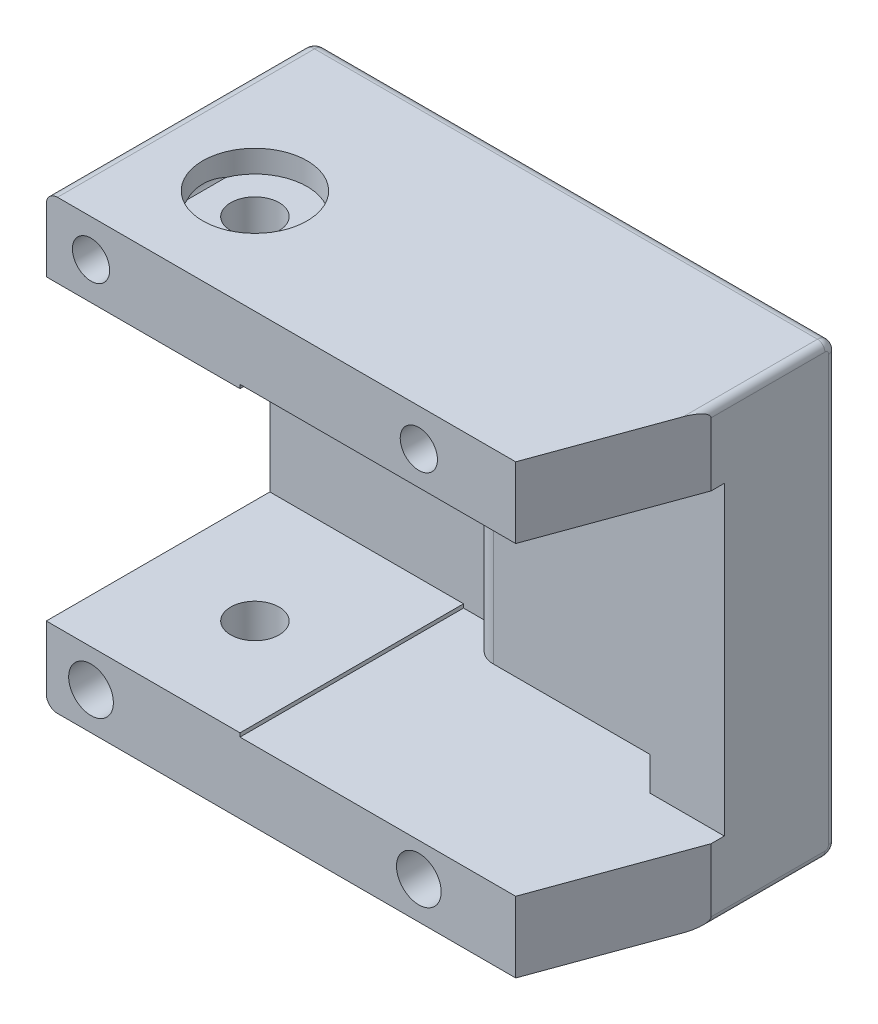
from build123d import *

# Parameters (mm, degrees)
SKETCH1_W              = 35
SKETCH1_H              = 20
BASE_PLATE_DEPTH       = 3
SKETCH2_W              = 35
SKETCH2_H              = 5
SIDE_WALLS_DEPTH       = 18
SKETCH4_R              = 1.5
SKETCH4_R_2            = 1.25
M2_SCREWS_DEPTH        = 18
SKETCH6_W              = 5
SKETCH6_H              = 20
RETURN_STOPPER_DEPTH   = 4.5
SKETCH9_W              = 12
SKETCH9_H              = 16
BOSS_EXTRUDE1_DEPTH    = 4.5
SKETCH7_R              = 7.75
MAGNET_POCKET_DEPTH    = 6
SKETCH8_R              = 2
M2_SCREW_HEAD_DEPTH    = 1.5
M3_ACHSLE_DEPTH        = 36.429507476
M3_ACHSLE_DEPTH_BACK   = 36.429507476
SKETCH5_R              = 1.625
SKETCH14_R             = 3.5
CUT_EXTRUDE1_DEPTH     = 1.5
CUT_EXTRUDE2_START     = -1.5
SKETCH15_R             = 3.5
CUT_EXTRUDE2_DEPTH     = 1.5
FILLET1_R              = 1.5
LEAVER_START           = -0.25
SKETCH11_W             = 22
SKETCH11_H             = 10.5
LEAVER_SPACE_DEPTH     = 20.5
SKETCH12_W             = 17
SKETCH12_H             = 4.5
MORE_SPACE_LEFT_DEPTH  = 0.25
SKETCH13_W             = 17
SKETCH13_H             = 4.5
MORE_SPACE_RIGHT_DEPTH = 0.25
FILLET2_R              = 0.75
FILLET3_R              = 0.75
FILLET4_R              = 0.75
FILLET5_R              = 0.5
CHAMFER1_SIZE          = 3.5
CHAMFER1_SIZE_2        = 9.616170968


with BuildPart() as part:
    # Sketch1 → Base Plate (new body)
    with BuildSketch(Plane.XY):
        Rectangle(SKETCH1_W, SKETCH1_H)
    extrude(amount=BASE_PLATE_DEPTH)

    # Sketch2 → Side Walls (add)
    with BuildSketch(Plane(origin=(0, 0, 0), x_dir=(1, 0, 0), z_dir=(0, 0, -1))):
        with Locations((0, -12.5)):
            Rectangle(SKETCH2_W, SKETCH2_H)
        with Locations((0, 12.5)):
            Rectangle(SKETCH2_W, SKETCH2_H)
    extrude(amount=-SIDE_WALLS_DEPTH)

    # Sketch4 → M2 Screws (cut)
    with BuildSketch(Plane.XY.offset(18)):
        with Locations((-14.5, -12.5)):
            Circle(SKETCH4_R)
        with Locations((7.5, -12.5)):
            Circle(SKETCH4_R)
        with Locations((7.5, 12.5)):
            Circle(SKETCH4_R_2)
        with Locations((-14.5, 12.5)):
            Circle(SKETCH4_R_2)
    extrude(amount=-M2_SCREWS_DEPTH, mode=Mode.SUBTRACT)

    # Sketch6 → Return Stopper (add)
    with BuildSketch(Plane.XY.offset(3)):
        with Locations((15, 0)):
            Rectangle(SKETCH6_W, SKETCH6_H)
    extrude(amount=RETURN_STOPPER_DEPTH)

    # Sketch9 → Boss-Extrude1 (add)
    with BuildSketch(Plane.XY.offset(3)):
        with Locations((6.5, 0)):
            Rectangle(SKETCH9_W, SKETCH9_H)
    extrude(amount=BOSS_EXTRUDE1_DEPTH)

    # Sketch7 → Magnet Pocket (cut)
    with BuildSketch(Plane(origin=(0, 0, 0), x_dir=(-1, 0, 0), z_dir=(0, 0, 1))):
        with Locations(Location((-8.75, 0, 0), (0, 0, 90))):
            Circle(SKETCH7_R)
    extrude(amount=MAGNET_POCKET_DEPTH, mode=Mode.SUBTRACT)

    # Sketch8 → M2 Screw Head (cut)
    with BuildSketch(Plane(origin=(0, 0, 0), x_dir=(1, 0, 0), z_dir=(0, 0, -1))):
        with Locations(Location((7.5, -12.5, 0), (0, 0, 270))):
            Circle(SKETCH8_R)
        with Locations(Location((-14.5, -12.5, 0), (0, 0, 270))):
            Circle(SKETCH8_R)
        with Locations(Location((7.5, 12.5, 0), (0, 0, 270))):
            Circle(SKETCH8_R)
        with Locations(Location((-14.5, 12.5, 0), (0, 0, 270))):
            Circle(SKETCH8_R)
    extrude(amount=-M2_SCREW_HEAD_DEPTH, mode=Mode.SUBTRACT)

    # Sketch5 → M3 Achsle (cut, two sides: drawn at the far end of the back side and taken through both)
    with BuildSketch(Plane.XZ.offset(-10).offset(-M3_ACHSLE_DEPTH_BACK)):
        with Locations((-10.5, 11)):
            Circle(SKETCH5_R)
    extrude(amount=M3_ACHSLE_DEPTH + M3_ACHSLE_DEPTH_BACK, mode=Mode.SUBTRACT)

    # Sketch14 → Cut-Extrude1 (cut)
    with BuildSketch(Plane(origin=(0, 15, 0), x_dir=(-1, 0, 0), z_dir=(0, 1, 0))):
        with Locations((10.5, 11)):
            Circle(SKETCH14_R)
    extrude(amount=-CUT_EXTRUDE1_DEPTH, mode=Mode.SUBTRACT)

    # Sketch15 → Cut-Extrude2 (cut)
    with BuildSketch(Plane.XZ.offset(15).offset(CUT_EXTRUDE2_START)):
        with Locations(Location((-10.5, 11, 0), (0, 0, 180))):
            Circle(SKETCH15_R)
    extrude(amount=CUT_EXTRUDE2_DEPTH, mode=Mode.SUBTRACT)

    # Fillet1
    fillet1_edges = [part.edges().sort_by_distance(p)[0] for p in [
        (0.5, 0, 7.5),
    ]]
    fillet(fillet1_edges, radius=FILLET1_R)

    # Sketch11 → Leaver Space (cut)
    with BuildSketch(Plane.XZ.offset(-10).offset(LEAVER_START)):
        with Locations((6.5, 12.75)):
            Rectangle(SKETCH11_W, SKETCH11_H)
    extrude(amount=LEAVER_SPACE_DEPTH, mode=Mode.SUBTRACT)

    # Sketch12 → More Space left (cut)
    with BuildSketch(Plane.XZ.offset(-10)):
        with Locations((4, 5.25)):
            Rectangle(SKETCH12_W, SKETCH12_H)
    extrude(amount=-MORE_SPACE_LEFT_DEPTH, mode=Mode.SUBTRACT)

    # Sketch13 → More Space right (cut)
    with BuildSketch(Plane(origin=(0, -10, 0), x_dir=(-1, 0, 0), z_dir=(0, 1, 0))):
        with Locations((-4, 5.25)):
            Rectangle(SKETCH13_W, SKETCH13_H)
    extrude(amount=-MORE_SPACE_RIGHT_DEPTH, mode=Mode.SUBTRACT)

    # Fillet2
    # the kernel refuses this fillet: 0.75 mm, written as the material it takes off along each edge
    with BuildSketch(Plane(origin=(19.375, 15, 0), x_dir=(0, -1, 0), z_dir=(-1, 0, 0))) as fillet2_piece_1:
        with BuildLine():
            CenterArc((FILLET2_R, FILLET2_R), FILLET2_R, 180, 90)
            Line((0, FILLET2_R), (0, 0))
            Line((0, 0), (FILLET2_R, 0))
        make_face()
    extrude(amount=38.75, mode=Mode.SUBTRACT)

    # Fillet3
    # the kernel refuses this fillet: 0.75 mm, written as the material it takes off along each edge
    with BuildSketch(Plane(origin=(-19.375, -15, 0), x_dir=(0, 1, 0), z_dir=(1, 0, 0))) as fillet3_piece_1:
        with BuildLine():
            CenterArc((FILLET3_R, FILLET3_R), FILLET3_R, 180, 90)
            Line((0, FILLET3_R), (0, 0))
            Line((0, 0), (FILLET3_R, 0))
        make_face()
    extrude(amount=38.75, mode=Mode.SUBTRACT)

    # Fillet4
    fillet4_edges = [part.edges().sort_by_distance(p)[0] for p in [
        (-17.5, -15, 9.375),
        (-17.5, 0, 0),
        (-17.5, 14.780330086, 0.219669914),
        (-17.5, -14.780330086, 0.219669914),
        (-17.5, 15, 9.375),
    ]]
    fillet(fillet4_edges, radius=FILLET4_R)

    # Fillet5
    fillet5_edges = [part.edges().sort_by_distance(p)[0] for p in [
        (17.5, -15, 9.375),
        (17.5, 14.780330086, 0.219669914),
        (17.5, 0, 0),
        (17.5, -14.780330086, 0.219669914),
        (17.5, 15, 9.375),
    ]]
    fillet(fillet5_edges, radius=FILLET5_R)

    # Chamfer1
    # the kernel refuses this chamfer: 9.616170968, 3.5 mm, written as the material it takes off along each edge
    with BuildSketch(Plane(origin=(17.5, -14.696220073, 18), x_dir=(-0.9950833631817486, 0, 0.09904090225205049), z_dir=(0, 1, 0))) as chamfer1_piece_1:
        Polygon((CHAMFER1_SIZE * 0.995083363182, -CHAMFER1_SIZE * 0.0990409022521), (-CHAMFER1_SIZE_2 * 0.099040902253, -CHAMFER1_SIZE_2 * 0.995083363191), (0, 0), align=None)
    extrude(amount=54.142440145, mode=Mode.SUBTRACT)
    with BuildSketch(Plane(origin=(17.5, -39.446220073, 18), x_dir=(0.013184058198645607, 0, -0.9999130865277316), z_dir=(0, 1, 0))) as chamfer1_piece_2:
        Polygon((CHAMFER1_SIZE_2 * 0.999913086537, CHAMFER1_SIZE_2 * 0.0131840581988), (-CHAMFER1_SIZE * 0.0131840581986, CHAMFER1_SIZE * 0.999913086528), (0, 0), align=None)
    extrude(amount=54.142440145, mode=Mode.SUBTRACT)


solid = part.part
